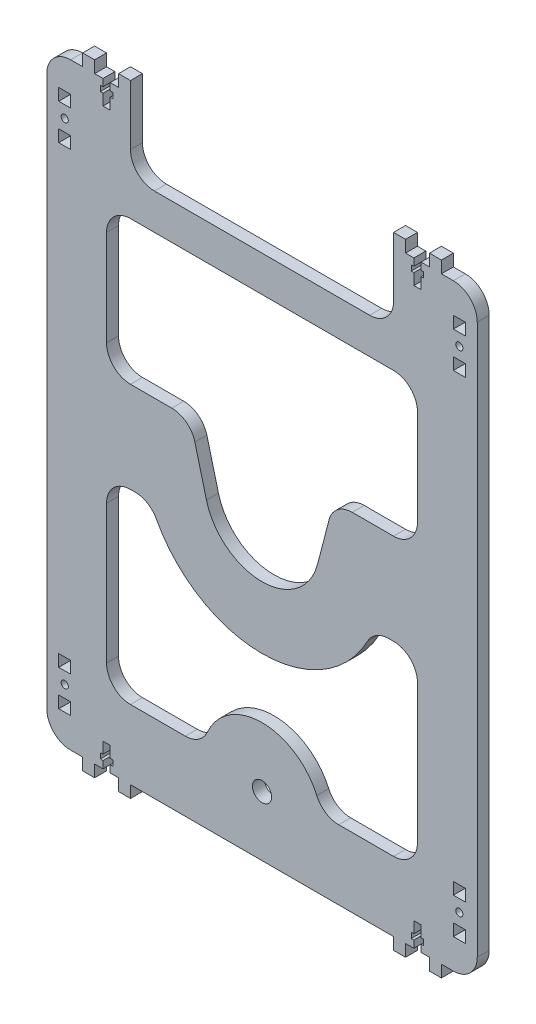
from build123d import *

# Parameters (mm, degrees)
SKETCH1_W           = 5
SKETCH1_H           = 5
SKETCH1_R           = 1.5
SKETCH1_R_2         = 4
BOSS_EXTRUDE1_DEPTH = 5
FILLET1_R           = 10


with BuildPart() as part:
    # Sketch1 → Boss-Extrude1 (new body)
    with BuildSketch(Plane.XY):
        Polygon((-75, 125), (-90, 125), (-90, -125), (-75, -125), (-75, -130), (-70, -130), (-70, -125), (-66.5, -125), (-66.5, -122), (-67.6, -122), (-67.6, -119.7), (-66.5, -119.7), (-66.5, -115), (-63.5, -115), (-63.5, -119.7), (-62.4, -119.7), (-62.4, -122), (-63.5, -122), (-63.5, -125), (-60, -125), (-60, -130), (-55, -130), (-55, -125), (55, -125), (55, -130), (60, -130), (60, -125), (63.5, -125), (63.5, -122), (62.4, -122), (62.4, -119.7), (63.5, -119.7), (63.5, -115), (66.5, -115), (66.5, -119.7), (67.6, -119.7), (67.6, -122), (66.5, -122), (66.5, -125), (70, -125), (70, -130), (75, -130), (75, -125), (90, -125), (90, 125), (75, 125), (75, 130), (70, 130), (70, 125), (66.5, 125), (66.5, 122), (67.6, 122), (67.6, 119.7), (66.5, 119.7), (66.5, 115), (63.5, 115), (63.5, 119.7), (62.4, 119.7), (62.4, 122), (63.5, 122), (63.5, 125), (60, 125), (60, 130), (55, 130), (55, 95), (-55, 95), (-55, 130), (-60, 130), (-60, 125), (-63.5, 125), (-63.5, 122), (-62.4, 122), (-62.4, 119.7), (-63.5, 119.7), (-63.5, 115), (-66.5, 115), (-66.5, 119.7), (-67.6, 119.7), (-67.6, 122), (-66.5, 122), (-66.5, 125), (-70, 125), (-70, 130), (-75, 130), align=None)
        with Locations((-82.5, -110)):
            Rectangle(SKETCH1_W, SKETCH1_H, mode=Mode.SUBTRACT)
        with Locations((-82.5, -102.5)):
            Circle(SKETCH1_R, mode=Mode.SUBTRACT)
        with Locations((-82.5, -95)):
            Rectangle(SKETCH1_W, SKETCH1_H, mode=Mode.SUBTRACT)
        with Locations((0, -100)):
            Circle(SKETCH1_R_2, mode=Mode.SUBTRACT)
        with Locations((82.5, -110)):
            Rectangle(SKETCH1_W, SKETCH1_H, mode=Mode.SUBTRACT)
        with Locations((82.5, -102.5)):
            Circle(SKETCH1_R, mode=Mode.SUBTRACT)
        with Locations((82.5, -95)):
            Rectangle(SKETCH1_W, SKETCH1_H, mode=Mode.SUBTRACT)
        with BuildLine():
            Line((-65, -18.081635275), (-46.616032283, -18.081635275))
            ThreePointArc((-46.616032283, -18.081635275), (0, -50), (46.616032283, -18.081635275))
            Line((46.616032283, -18.081635275), (65, -18.081635275))
            Line((65, -18.081635275), (65, -95.958016924))
            Line((65, -95.958016924), (24.671083738, -95.958016924))
            ThreePointArc((24.671083738, -95.958016924), (0, -75), (-24.671083738, -95.958016924))
            Line((-24.671083738, -95.958016924), (-65, -95.958016924))
            Line((-65, -95.958016924), (-65, -18.081635275))
        make_face(mode=Mode.SUBTRACT)
        with Locations((-82.5, 95)):
            Rectangle(SKETCH1_W, SKETCH1_H, mode=Mode.SUBTRACT)
        with Locations((-82.5, 102.5)):
            Circle(SKETCH1_R, mode=Mode.SUBTRACT)
        with Locations((-82.5, 110)):
            Rectangle(SKETCH1_W, SKETCH1_H, mode=Mode.SUBTRACT)
        with BuildLine():
            ThreePointArc((23.227291604, -6.040937406), (0, -24), (-23.227291604, -6.040937406))
            Line((-23.227291604, -6.040937406), (-30, 20))
            Line((-30, 20), (-65, 20))
            Line((-65, 20), (-65, 80))
            Line((-65, 80), (65, 80))
            Line((65, 80), (65, 20))
            Line((65, 20), (30, 20))
            Line((30, 20), (23.227291604, -6.040937406))
        make_face(mode=Mode.SUBTRACT)
        with Locations((82.5, 95)):
            Rectangle(SKETCH1_W, SKETCH1_H, mode=Mode.SUBTRACT)
        with Locations((82.5, 102.5)):
            Circle(SKETCH1_R, mode=Mode.SUBTRACT)
        with Locations((82.5, 110)):
            Rectangle(SKETCH1_W, SKETCH1_H, mode=Mode.SUBTRACT)
    extrude(amount=BOSS_EXTRUDE1_DEPTH)

    # Fillet1
    fillet1_edges = [part.edges().sort_by_distance(p)[0] for p in [
        (-90, -125, 2.5),
        (90, -125, 2.5),
        (-90, 125, 2.5),
        (90, 125, 2.5),
        (-55, 95, 2.5),
        (55, 95, 2.5),
        (24.671083738, -95.958016924, 2.5),
        (-24.671083738, -95.958016924, 2.5),
        (-65, -95.958016924, 2.5),
        (65, -95.958016924, 2.5),
        (65, -18.081635275, 2.5),
        (46.616032283, -18.081635275, 2.5),
        (-46.616032283, -18.081635275, 2.5),
        (-65, -18.081635275, 2.5),
        (65, 80, 2.5),
        (-65, 80, 2.5),
        (65, 20, 2.5),
        (-65, 20, 2.5),
        (30, 20, 2.5),
        (-30, 20, 2.5),
    ]]
    fillet(fillet1_edges, radius=FILLET1_R)


solid = part.part
